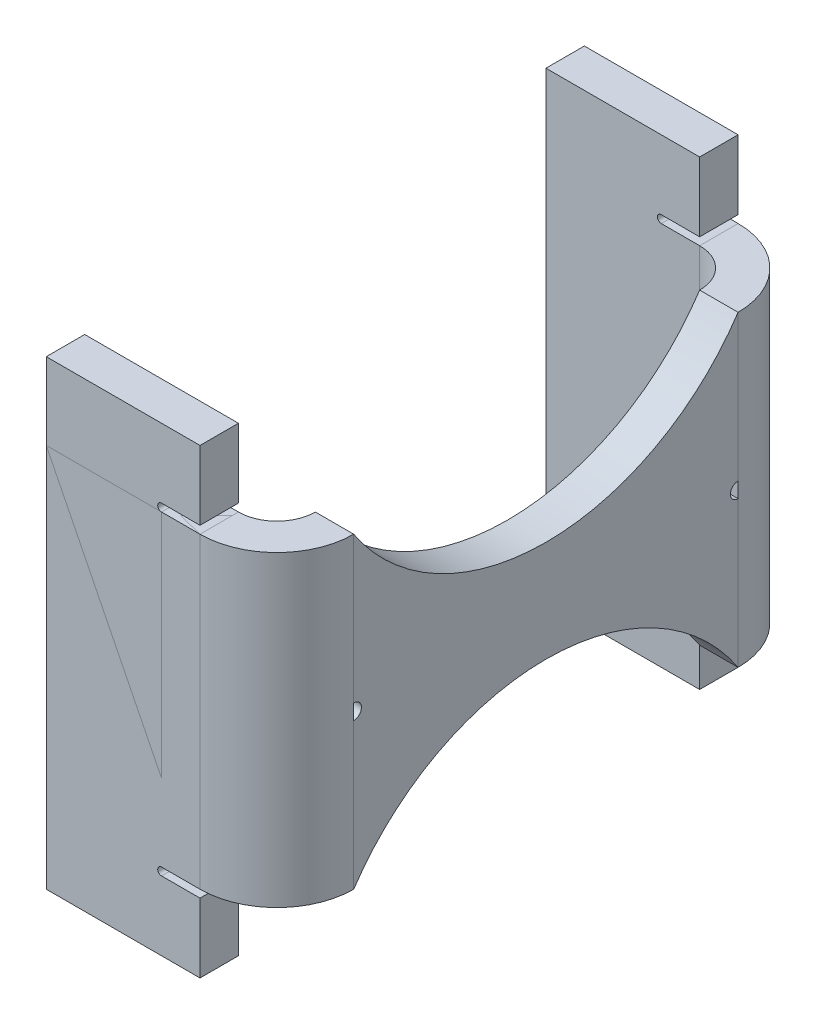
from build123d import *

# Parameters (mm, degrees)
SKETCH1_W                    = 6
SKETCH1_H                    = 3
BASE_FLANGE1_DEPTH           = 0.5
EDGE_FLANGE1_DEPTH           = 0.5
EDGE_FLANGE1_2_OUTLINE_W     = 0.5
EDGE_FLANGE1_2_OUTLINE_H     = 4
EDGE_FLANGE1_2_DEPTH         = 0.04719
EDGE_FLANGE1_START           = 1
EDGE_FLANGE1_3_OUTLINE_W     = 0.5
EDGE_FLANGE1_3_OUTLINE_H     = 4
EDGE_FLANGE1_3_DEPTH         = 6
EDGE_FLANGE1_START_2         = -2
EDGE_FLANGE1_4_DEPTH         = 4
EDGE_FLANGE1_5_DEPTH         = 4
BOSS_EXTRUDE2_DEPTH          = 0.5
EDGE_FLANGE2_STRIP_W         = 3
EDGE_FLANGE2_STRIP_H         = 0.5
EDGE_FLANGE2_STRIP_CUT_DEPTH = 4
EDGE_FLANGE2_DEPTH           = 4
CUT_EXTRUDE1_DEPTH           = 8.762087348
CUT_EXTRUDE1_DEPTH_BACK      = 8.762087348
SKETCH14_W                   = 1
SKETCH14_H                   = 0.9
CUT_EXTRUDE2_DEPTH           = 9.185352772
CUT_EXTRUDE2_DEPTH_BACK      = 9.185352772


with BuildPart() as part:
    # Base-Flange1: sheet metal written as solids
    # Sketch1 → Base-Flange1 (new body)
    with BuildSketch(Plane(origin=(0, 0, 0), x_dir=(0, 1, 0), z_dir=(0, 0, 1))):
        with Locations((0, 1.5)):
            Rectangle(SKETCH1_W, SKETCH1_H)
    extrude(amount=BASE_FLANGE1_DEPTH)

    # Edge-Flange1: read off the stored shape, not the designer's step
    # Edge-Flange1 outline → Edge-Flange1 (cut)
    with BuildSketch(Plane.XY):
        with BuildLine():
            Line((-1.5, 2), (0, 2))
            Line((0, 2), (0, 2.1))
            Line((0, 2.1), (-1.5, 2.1))
            ThreePointArc((-1.5, 2.1), (-1.55, 2.05), (-1.5, 2))
        make_face()
        with BuildLine():
            Line((0, -2.1), (0, -2))
            Line((0, -2), (-1.5, -2))
            ThreePointArc((-1.5, -2), (-1.55, -2.05), (-1.5, -2.1))
            Line((-1.5, -2.1), (0, -2.1))
        make_face()
    extrude(amount=EDGE_FLANGE1_DEPTH, mode=Mode.SUBTRACT)

    # Edge-Flange1 2 outline → Edge-Flange1 2 (cut)
    with BuildSketch(Plane.XY):
        with Locations((-0.25, 0)):
            Rectangle(EDGE_FLANGE1_2_OUTLINE_W, EDGE_FLANGE1_2_OUTLINE_H)
    extrude(amount=EDGE_FLANGE1_2_DEPTH, mode=Mode.SUBTRACT)

    # Edge-Flange1 4 outline → Edge-Flange1 4 (cut)
    with BuildSketch(Plane(origin=(0, 0, 0), x_dir=(1, 0, 0), z_dir=(0, 1, 0)).offset(EDGE_FLANGE1_START_2)):
        with BuildLine():
            ThreePointArc((-1, 0), (-0.5, -0.133974596), (-0.133974596, -0.5))
            Line((-0.133974596, -0.5), (0, -0.5))
            Line((0, -0.5), (0, -0.04719))
            Line((0, -0.04719), (-0.5, -0.04719))
            Line((-0.5, -0.04719), (-0.5, 0))
            Line((-0.5, 0), (-1, 0))
        make_face()
    extrude(amount=EDGE_FLANGE1_4_DEPTH, mode=Mode.SUBTRACT)



with BuildPart() as body_2:
    # Edge-Flange1 3 outline → Edge-Flange1 3 (new body)
    with BuildSketch(Plane.XY.offset(EDGE_FLANGE1_START)):
        with Locations((-0.25, 0)):
            Rectangle(EDGE_FLANGE1_3_OUTLINE_W, EDGE_FLANGE1_3_OUTLINE_H)
    extrude(amount=EDGE_FLANGE1_3_DEPTH)


with BuildPart() as part_1:
    add(part.part)

    add(body_2.part)  # Edge-Flange1 5 merges body 2
    # Edge-Flange1 5 outline → Edge-Flange1 5 (add)
    with BuildSketch(Plane(origin=(0, 0, 0), x_dir=(1, 0, 0), z_dir=(0, 1, 0)).offset(EDGE_FLANGE1_START_2)):
        with BuildLine():
            Line((-0.5, -1), (0, -1))
            ThreePointArc((0, -1), (-0.034074174, -0.741180955), (-0.133974596, -0.5))
            Line((-0.133974596, -0.5), (-1, -0.5))
            ThreePointArc((-1, -0.5), (-0.646446609, -0.646446609), (-0.5, -1))
        make_face()
    extrude(amount=EDGE_FLANGE1_5_DEPTH)

    # Edge-Flange2: sheet metal written as solids
    # Edge-Flange2 strip (on a plane across the edge) → Edge-Flange2 strip cut (cut)
    with BuildSketch(Plane(origin=(-0.5, -2, 7), x_dir=(0, 0, -1), z_dir=(0, 1, 0))):
        with Locations((-0.5, -0.25)):
            Rectangle(EDGE_FLANGE2_STRIP_W, EDGE_FLANGE2_STRIP_H)
    extrude(amount=EDGE_FLANGE2_STRIP_CUT_DEPTH, mode=Mode.SUBTRACT)

    # Edge-Flange2 section (on a plane across the edge) → Edge-Flange2 (add)
    with BuildSketch(Plane(origin=(-0.5, -2, 7), x_dir=(0, 0, -1), z_dir=(0, 1, 0))):
        with BuildLine():
            Line((0, 0.5), (0, 2.5))
            Line((0, 2.5), (0.5, 2.5))
            Line((0.5, 2.5), (0.5, 0.5))
            ThreePointArc((0.5, 0.5), (0.646446609, 0.146446609), (1, 0))
            Line((1, 0), (1, -0.5))
            ThreePointArc((1, -0.5), (0.292893219, -0.207106781), (0, 0.5))
        make_face()
    extrude(amount=EDGE_FLANGE2_DEPTH)


with BuildPart() as body_2_2:
    # Sketch10 → Boss-Extrude2 (new body)
    with BuildSketch(Plane(origin=(0, 0, 7), x_dir=(0, 1, 0), z_dir=(0, 0, 1))):
        with BuildLine():
            Line((3, 3), (-3, 3))
            Line((-3, 3), (-3, 0))
            Line((-3, 0), (-2.1, 0))
            Line((-2.1, 0), (-2.1, 1.5))
            ThreePointArc((-2.1, 1.5), (-2.05, 1.55), (-2, 1.5))
            Line((-2, 1.5), (-2, 1))
            Line((-2, 1), (2, 1))
            Line((2, 1), (2, 1.5))
            ThreePointArc((2, 1.5), (2.05, 1.55), (2.1, 1.5))
            Line((2.1, 1.5), (2.1, 0))
            Line((2.1, 0), (3, 0))
            Line((3, 0), (3, 3))
        make_face()
    extrude(amount=-BOSS_EXTRUDE2_DEPTH)


with BuildPart() as cut_extrude1_tool:
    # Sketch14 → Cut-Extrude1 (new, two sides: drawn at the far end of the back side and taken through both)
    with BuildSketch(Plane.XY.offset(0.5).offset(-CUT_EXTRUDE1_DEPTH_BACK)):
        with Locations((-0.5, 2.55)):
            Rectangle(SKETCH14_W, SKETCH14_H)
        with Locations((-0.5, -2.55)):
            Rectangle(SKETCH14_W, SKETCH14_H)
    extrude(amount=CUT_EXTRUDE1_DEPTH + CUT_EXTRUDE1_DEPTH_BACK)


with BuildPart() as part_2:
    add(part_1.part)

    # Cut-Extrude1: cut by cut_extrude1_tool
    add(cut_extrude1_tool.part, mode=Mode.SUBTRACT)

    # Sketch15 → Cut-Extrude2 (cut, two sides: drawn at the far end of the back side and taken through both)
    with BuildSketch(Plane.YZ.offset(-CUT_EXTRUDE2_DEPTH_BACK)):
        with BuildLine():
            Line((-2, 6), (-2, 1))
            ThreePointArc((-2, 1), (-0.658312395, 3.5), (-2, 6))
        make_face()
        with BuildLine():
            Line((2, 6), (2, 1))
            ThreePointArc((2, 1), (0.658312395, 3.5), (2, 6))
        make_face()
        with BuildLine():
            Line((-0.1, 6), (0.1, 6))
            ThreePointArc((0.1, 6), (0, 5.9), (-0.1, 6))
        make_face()
        with BuildLine():
            Line((-0.1, 1), (0.1, 1))
            ThreePointArc((0.1, 1), (0, 1.1), (-0.1, 1))
        make_face()
    extrude(amount=CUT_EXTRUDE2_DEPTH + CUT_EXTRUDE2_DEPTH_BACK, mode=Mode.SUBTRACT)


with BuildPart() as body_2_2_1:
    add(body_2_2.part)

    # Cut-Extrude1: cut by cut_extrude1_tool
    add(cut_extrude1_tool.part, mode=Mode.SUBTRACT)


solid = Compound([part_2.part, body_2_2_1.part])
